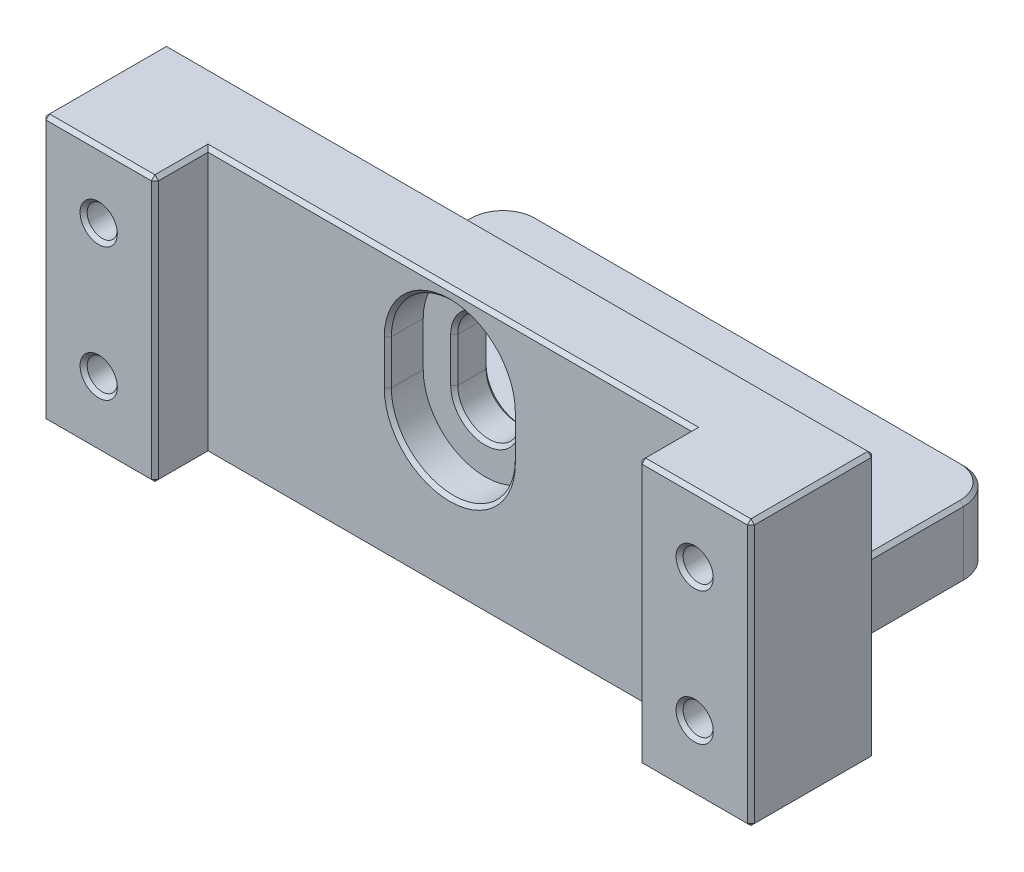
from build123d import *

# Parameters (mm, degrees)
BOSS_EXTRUDE1_DEPTH                            = 30
SKETCH2_W                                      = 80
SKETCH2_H                                      = 26
BOSS_EXTRUDE2_DEPTH                            = 8
CBORE_FOR_M3_HEX_SOCKET_HEAD_CAP_SCR_2_COUNT   = 2
CBORE_FOR_M3_HEX_SOCKET_HEAD_CAP_SCR_2_PITCH   = 45
SKETCH5_W                                      = 12
SKETCH5_H                                      = 26
CUT_EXTRUDE1_DEPTH                             = 8
FILLET1_R                                      = 4
CBORE_FOR_M3_HEX_SOCKET_HEAD_CAP_SCR_3_COUNT   = 2
CBORE_FOR_M3_HEX_SOCKET_HEAD_CAP_SCR_3_PITCH   = 68.951359668
CBORE_FOR_M3_HEX_SOCKET_HEAD_CAP_SCR_4_COUNT   = 2
CBORE_FOR_M3_HEX_SOCKET_HEAD_CAP_SCR_4_PITCH   = 67.3
CBORE_FOR_M3_HEX_SOCKET_HEAD_CAP_SCR_5_COUNT   = 2
CBORE_FOR_M3_HEX_SOCKET_HEAD_CAP_SCR_5_PITCH   = 15
CBORE_START                                    = -10
CBORE_SLOT_FOR_M6_HEX_SOCKET_HEAD_CAP_SC_DEPTH = 4
CBORE_START_2                                  = -14
CBORE_SLOT_FOR_M6_HEX_SOCKET_HEAD_CA_3_DEPTH   = 4
CHAMFER1_SIZE                                  = 0.4


# Read off the part's stored shape, not the designer's step: CBORE SLOT for M6 Hex Socket Head Cap Screw2
with BuildPart() as part:
    # Sketch1 → Boss-Extrude1 (new body)
    with BuildSketch(Plane(origin=(0, 0, 0), x_dir=(1, 0, 0), z_dir=(0, 1, 0))):
        Polygon((-40, 14), (-40, 0), (-27.3, 0), (-27.3, 6), (27.3, 6), (27.3, 0), (40, 0), (40, 14), align=None)
    extrude(amount=BOSS_EXTRUDE1_DEPTH)

    # Sketch2 → Boss-Extrude2 (add)
    with BuildSketch(Plane.XZ):
        with Locations((0, -27)):
            Rectangle(SKETCH2_W, SKETCH2_H)
    extrude(amount=-BOSS_EXTRUDE2_DEPTH)

    # Sketch4 → CBORE for M3 Hex Socket Head Cap Screw1 (revolve, cut)
    with BuildSketch(Plane(origin=(-22.5, 0, -26.5), x_dir=(0, 0, -1), z_dir=(1, 0, 0))):
        Polygon((0, 0), (0, 21.021463052), (1.7, 20), (1.7, 3.4), (3.25, 3.4), (3.25, 0.025), (3.275, 0), align=None)
    cbore_for_m3_hex_socket_head_cap_screw1 = revolve(axis=Axis((-22.5, -6.35, -26.5), (0, 1, 0)), mode=Mode.SUBTRACT)

    # CBORE for M3 Hex Socket Head Cap Scr 2: CBORE for M3 Hex Socket Head Cap Screw1 ×2
    with Locations(*[(i * CBORE_FOR_M3_HEX_SOCKET_HEAD_CAP_SCR_2_PITCH, 0, 0) for i in range(1, CBORE_FOR_M3_HEX_SOCKET_HEAD_CAP_SCR_2_COUNT)]):
        add(cbore_for_m3_hex_socket_head_cap_screw1, mode=Mode.SUBTRACT)

    # Sketch5 → Cut-Extrude1 (cut)
    with BuildSketch(Plane.XZ):
        with Locations((-34, -27)):
            Rectangle(SKETCH5_W, SKETCH5_H)
        with Locations((34, -27)):
            Rectangle(SKETCH5_W, SKETCH5_H)
    extrude(amount=-CUT_EXTRUDE1_DEPTH, mode=Mode.SUBTRACT)

    # Fillet1
    fillet1_edges = [part.edges().sort_by_distance(p)[0] for p in [
        (28, 4, -40),
        (-28, 4, -40),
    ]]
    fillet(fillet1_edges, radius=FILLET1_R)

    # Sketch7 → CBORE for M3 Hex Socket Head Cap Screw2 (revolve, cut)
    with BuildSketch(Plane(origin=(33.65, 22.5, -14), x_dir=(0, 1, 0), z_dir=(1, 0, 0))):
        Polygon((0, 0), (0, 21.021463052), (1.7, 20), (1.7, 4.4), (3.25, 4.4), (3.25, 0.025), (3.275, 0), align=None)
    cbore_for_m3_hex_socket_head_cap_screw2 = revolve(axis=Axis((33.65, 22.5, -20.35), (0, 0, 1)), mode=Mode.SUBTRACT)

    # CBORE for M3 Hex Socket Head Cap Scr 3: CBORE for M3 Hex Socket Head Cap Screw2 ×2
    with Locations(*[Vector(-0.9760503683250792, -0.2175446586162881, 0) * (i * CBORE_FOR_M3_HEX_SOCKET_HEAD_CAP_SCR_3_PITCH) for i in range(1, CBORE_FOR_M3_HEX_SOCKET_HEAD_CAP_SCR_3_COUNT)]):
        add(cbore_for_m3_hex_socket_head_cap_screw2, mode=Mode.SUBTRACT)

    # CBORE for M3 Hex Socket Head Cap Scr 4: CBORE for M3 Hex Socket Head Cap Screw2 ×2
    with Locations(*[(-i * CBORE_FOR_M3_HEX_SOCKET_HEAD_CAP_SCR_4_PITCH, 0, 0) for i in range(1, CBORE_FOR_M3_HEX_SOCKET_HEAD_CAP_SCR_4_COUNT)]):
        add(cbore_for_m3_hex_socket_head_cap_screw2, mode=Mode.SUBTRACT)

    # CBORE for M3 Hex Socket Head Cap Scr 5: CBORE for M3 Hex Socket Head Cap Screw2 ×2
    with Locations(*[(0, -i * CBORE_FOR_M3_HEX_SOCKET_HEAD_CAP_SCR_5_PITCH, 0) for i in range(1, CBORE_FOR_M3_HEX_SOCKET_HEAD_CAP_SCR_5_COUNT)]):
        add(cbore_for_m3_hex_socket_head_cap_screw2, mode=Mode.SUBTRACT)

    # CBORE SLOT for M6 Hex Socket Head Ca 2 → CBORE SLOT for M6 Hex Socket Head Cap Screw2 (cut)
    with BuildSketch(Plane.XY.offset(CBORE_START)):
        with BuildLine():
            Line((7, 16.5), (7, 21.5))
            ThreePointArc((7, 21.5), (0, 28.5), (-7, 21.5))
            Line((-7, 21.5), (-7, 16.5))
            ThreePointArc((-7, 16.5), (0, 9.5), (7, 16.5))
        make_face()
    extrude(amount=CBORE_SLOT_FOR_M6_HEX_SOCKET_HEAD_CAP_SC_DEPTH, mode=Mode.SUBTRACT)

    # CBORE SLOT for M6 Hex Socket Head Ca 3 o → CBORE SLOT for M6 Hex Socket Head Ca 3 (cut)
    with BuildSketch(Plane.XY.offset(CBORE_START_2)):
        with BuildLine():
            Line((3.5, 16.5), (3.5, 21.5))
            ThreePointArc((3.5, 21.5), (0, 25), (-3.5, 21.5))
            Line((-3.5, 21.5), (-3.5, 16.5))
            ThreePointArc((-3.5, 16.5), (0, 13), (3.5, 16.5))
        make_face()
    extrude(amount=CBORE_SLOT_FOR_M6_HEX_SOCKET_HEAD_CA_3_DEPTH, mode=Mode.SUBTRACT)

    # Chamfer1
    chamfer1_edges = [part.edges().sort_by_distance(p)[0] for p in [
        (33.65, 20.8, 0),
        (40, 0, -7),
        (33.65, 5.8, 0),
        (33.65, 0, 0),
        (-33.65, 30, 0),
        (27.3, 0, -3),
        (-33.65, 20.8, 0),
        (0, 0, -6),
        (-27.3, 0, -3),
        (-33.65, 5.8, 0),
        (-33.65, 0, 0),
        (3.5, 19, -14),
        (0, 13, -14),
        (0, 25, -14),
        (-3.5, 19, -14),
        (-3.5, 19, -10),
        (7, 19, -6),
        (0, 28.5, -6),
        (0, 9.5, -6),
        (0, 25, -10),
        (0, 13, -10),
        (3.5, 19, -10),
        (-7, 19, -6),
        (-27.3, 30, -3),
        (-40, 15, -14),
        (40, 15, -14),
        (40, 15, 0),
        (27.3, 15, 0),
        (-27.3, 15, 0),
        (-40, 15, 0),
        (0, 30, -6),
        (27.3, 30, -3),
        (33.65, 30, 0),
        (40, 30, -7),
        (0, 30, -14),
        (-22.5, 8, -24.8),
        (22.5, 8, -24.8),
        (-40, 30, -7),
        (-40, 0, -7),
        (34, 0, -14),
        (-34, 0, -14),
        (-28, 0, -25),
        (-28, 8, -25),
        (28, 0, -25),
        (0, 0, -40),
        (26.828427125, 0, -38.828427125),
        (-26.828427125, 0, -38.828427125),
        (0, 8, -40),
        (28, 8, -25),
        (26.828427125, 8, -38.828427125),
        (-26.828427125, 8, -38.828427125),
    ]]
    chamfer(chamfer1_edges, length=CHAMFER1_SIZE)


solid = part.part
